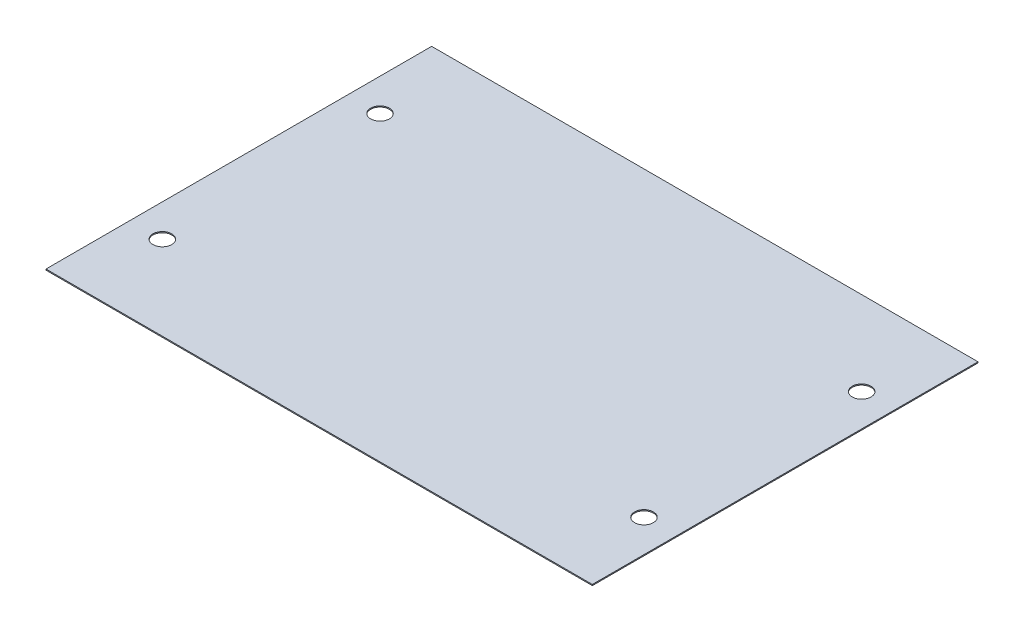
from build123d import *

# Parameters (mm, degrees)
SKETCH2_W           = 51
SKETCH2_H           = 36
SKETCH2_R           = 0.875
BOSS_EXTRUDE2_DEPTH = 0.1


with BuildPart() as part:
    # Sketch2 → Boss-Extrude2 (new body)
    with BuildSketch(Plane(origin=(0, 0, 0), x_dir=(1, 0, 0), z_dir=(0, 1, 0))):
        with Locations((-24.428903971, 3.431275587)):
            Rectangle(SKETCH2_W, SKETCH2_H)
        with Locations((-1.948903971, 13.591275587)):
            Circle(SKETCH2_R, mode=Mode.SUBTRACT)
        with Locations((-46.908903971, 13.591275587)):
            Circle(SKETCH2_R, mode=Mode.SUBTRACT)
        with Locations((-46.908903971, -6.728724413)):
            Circle(SKETCH2_R, mode=Mode.SUBTRACT)
        with Locations((-1.948903971, -6.728724413)):
            Circle(SKETCH2_R, mode=Mode.SUBTRACT)
    extrude(amount=BOSS_EXTRUDE2_DEPTH)


solid = part.part
